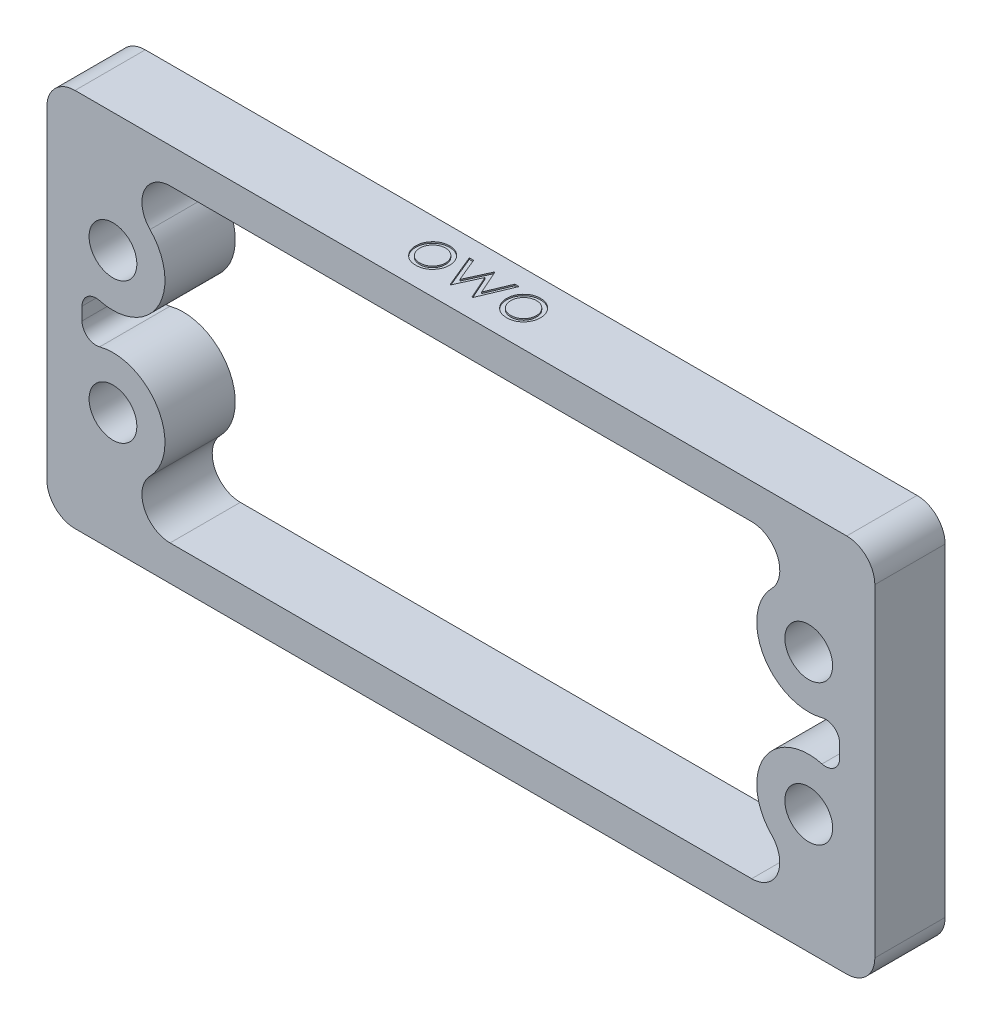
from build123d import *

# Parameters (mm, degrees)
BOSS_EXTRUDE1_OUTLINE_R   = 1.7
BOSS_EXTRUDE1_OUTLINE_R_2 = 1.699388982
BOSS_EXTRUDE1_DEPTH       = 5
FILLET1_R                 = 2
FILLET2_R                 = 1
CUT_EXTRUDE2_DEPTH        = 0.1


# Read off the part's stored shape, not the designer's step: Boss-Extrude1
with BuildPart() as part:
    # Boss-Extrude1 outline → Boss-Extrude1 (new body)
    with BuildSketch(Plane.XY):
        Polygon((29.451299039, 17), (-29.45000185, 17), (-29.45000185, -9.999066432), (29.451299039, -9.998874323), align=None)
        with Locations((-24.75, -1.5)):
            Circle(BOSS_EXTRUDE1_OUTLINE_R, mode=Mode.SUBTRACT)
        with Locations((24.75, -1.5)):
            Circle(BOSS_EXTRUDE1_OUTLINE_R, mode=Mode.SUBTRACT)
        with Locations((-24.75, 8.5)):
            Circle(BOSS_EXTRUDE1_OUTLINE_R, mode=Mode.SUBTRACT)
        with BuildLine():
            Line((26.951299039, 14.5), (22.6554979, 11.549350717))
            ThreePointArc((22.6554979, 11.549350717), (21.738264413, 6.351761747), (26.951299039, 5.526826378))
            Line((26.951299039, 5.526826378), (26.951299039, 1.47393385))
            ThreePointArc((26.951299039, 1.47393385), (21.737319782, 0.647965992), (22.656048895, -4.550470254))
            Line((22.656048895, -4.550470254), (26.951299039, -7.498882477))
            Line((26.951299039, -7.498882477), (-26.95000185, -7.499058278))
            Line((-26.95000185, -7.499058278), (-22.65553415, -4.550116851))
            ThreePointArc((-22.65553415, -4.550116851), (-21.737032665, 0.647563233), (-26.95000185, 1.474893588))
            Line((-26.95000185, 1.474893588), (-26.95000185, 5.525106412))
            ThreePointArc((-26.95000185, 5.525106412), (-21.737192663, 6.352212312), (-22.655079717, 11.549804749))
            Line((-22.655079717, 11.549804749), (-26.95000185, 14.5))
            Line((-26.95000185, 14.5), (26.951299039, 14.5))
        make_face(mode=Mode.SUBTRACT)
        with Locations((24.75, 8.5)):
            Circle(BOSS_EXTRUDE1_OUTLINE_R_2, mode=Mode.SUBTRACT)
    extrude(amount=BOSS_EXTRUDE1_DEPTH)

    # Fillet1
    fillet1_edges = [part.edges().sort_by_distance(p)[0] for p in [
        (26.951299039, -7.498882477, 2.5),
        (-26.95000185, -7.499058278, 2.5),
        (26.951299039, 14.5, 2.5),
        (-26.95000185, 14.5, 2.5),
        (29.451299039, 17, 2.5),
        (-29.45000185, 17, 2.5),
        (-29.45000185, -9.999066432, 2.5),
        (29.451299039, -9.998874323, 2.5),
    ]]
    fillet(fillet1_edges, radius=FILLET1_R)

    # Fillet2
    fillet2_edges = [part.edges().sort_by_distance(p)[0] for p in [
        (-26.95000185, 5.525106412, 2.5),
        (-26.95000185, 1.474893588, 2.5),
        (26.951299039, 1.47393385, 2.5),
        (26.951299039, 5.526826378, 2.5),
    ]]
    fillet(fillet2_edges, radius=FILLET2_R)

    # Sketch4 → Cut-Extrude2 (cut)
    # profile 1 of 3: a face of its own
    with BuildSketch(Plane(origin=(0, 17, 0), x_dir=(1, 0, 0), z_dir=(0, 1, 0))):
        with BuildLine():
            add(Edge.make_bspline(
                [(-4.553692525, -1.249305998), (-4.510157585, -1.250232999), (-4.424796206, -1.252050622), (-4.299784767, -1.271477055), (-4.180454536, -1.301183593), (-4.066348491, -1.342251367), (-3.958927994, -1.397298565), (-3.856628366, -1.462984136), (-3.759730079, -1.540801203), (-3.701652045, -1.600997451), (-3.672172093, -1.631552593)],
                knots=[0, 0, 0, 0, 1.054011418, 2.066658804, 3.057071809, 4.030435133, 4.997543892, 5.974964718, 6.972108034, 8, 8, 8, 8], degree=3))
            add(Edge.make_bspline(
                [(-3.672172093, -1.631552593), (-3.646788463, -1.66077528), (-3.596512446, -1.718655114), (-3.532045687, -1.812504135), (-3.476508986, -1.909695512), (-3.432001872, -2.011519872), (-3.396909029, -2.117088324), (-3.371993719, -2.22676372), (-3.357173785, -2.340303849), (-3.355175379, -2.417414474), (-3.354163278, -2.456467456)],
                knots=[0, 0, 0, 0, 1.025258237, 2.030674902, 3.01204498, 3.988269485, 4.97094183, 5.956517959, 6.965070386, 8, 8, 8, 8], degree=3))
            add(Edge.make_bspline(
                [(-3.354163278, -2.456467456), (-3.355053492, -2.495746794), (-3.356812594, -2.573364598), (-3.373452875, -2.687682166), (-3.399334646, -2.798530326), (-3.436374956, -2.905444998), (-3.483871241, -3.008752992), (-3.541829222, -3.108003083), (-3.610655617, -3.20339109), (-3.688673529, -3.294107043), (-3.774899159, -3.377714966), (-3.868440236, -3.450584182), (-3.967458539, -3.513015137), (-4.073270723, -3.563303885), (-4.184910515, -3.602954827), (-4.302618712, -3.630804128), (-4.426212455, -3.647642227), (-4.510601434, -3.649804468), (-4.553692525, -3.650908562)],
                knots=[0, 0, 0, 0, 0.998656419, 1.973391657, 2.932242238, 3.890759089, 4.846373663, 5.82037756, 6.809684879, 7.83454468, 8.860553229, 9.859544525, 10.845671541, 11.83227036, 12.833544569, 13.85385346, 14.904124723, 16, 16, 16, 16], degree=3))
            add(Edge.make_bspline(
                [(-4.553692525, -3.650908562), (-4.596994735, -3.649800763), (-4.681804301, -3.647631081), (-4.805834299, -3.630869546), (-4.923753453, -3.602967662), (-5.035539396, -3.56317358), (-5.141806507, -3.513013529), (-5.241398544, -3.450772925), (-5.33501561, -3.377693356), (-5.421259481, -3.294112898), (-5.499272502, -3.203389581), (-5.568100159, -3.108003475), (-5.626057812, -3.00875289), (-5.673554183, -2.905445026), (-5.710594471, -2.798530319), (-5.736476247, -2.687682168), (-5.753116526, -2.573364598), (-5.754875629, -2.495746794), (-5.755765843, -2.456467456)],
                knots=[0, 0, 0, 0, 1.099876186, 2.154163076, 3.173186993, 4.173200201, 5.163417411, 6.152872554, 7.150605724, 8.17532212, 9.198891216, 10.186952605, 11.159729845, 12.11414092, 13.071450619, 14.029093627, 15.002601286, 16, 16, 16, 16], degree=3))
            add(Edge.make_bspline(
                [(-5.755765843, -2.456467456), (-5.75474684, -2.417626733), (-5.752729389, -2.340728775), (-5.737924356, -2.227402084), (-5.713106237, -2.11791231), (-5.677971327, -2.012751342), (-5.633053975, -1.911373196), (-5.578297664, -1.813941671), (-5.513173304, -1.720517024), (-5.463097248, -1.662711994), (-5.437757028, -1.633460645)],
                knots=[0, 0, 0, 0, 1.031353054, 2.041901799, 3.029428768, 4.008703097, 4.981709435, 5.96992636, 6.972712378, 8, 8, 8, 8], degree=3))
            add(Edge.make_bspline(
                [(-5.437757028, -1.633460645), (-5.408321521, -1.602640522), (-5.350431416, -1.542027326), (-5.253050784, -1.464437108), (-5.151002818, -1.397384669), (-5.042395206, -1.343431245), (-4.9283829, -1.300942019), (-4.808441158, -1.271400444), (-4.683005512, -1.252120615), (-4.597226427, -1.250253554), (-4.553692525, -1.249305998)],
                knots=[0, 0, 0, 0, 1.027980169, 2.021703884, 2.998553061, 3.971491411, 4.943284454, 5.930300938, 6.949603206, 8, 8, 8, 8], degree=3))
        make_face()
        with BuildLine():
            add(Edge.make_bspline(
                [(-4.554964561, -1.534241895), (-4.585750822, -1.535116918), (-4.646528603, -1.536844374), (-4.735990655, -1.549983345), (-4.822114938, -1.570800009), (-4.905064846, -1.600376546), (-4.984560653, -1.638566261), (-5.060678468, -1.685473131), (-5.133642181, -1.740475884), (-5.202024481, -1.803488451), (-5.264782722, -1.872321539), (-5.319644886, -1.94566255), (-5.366294804, -2.022321878), (-5.405156948, -2.102379241), (-5.434101326, -2.186645931), (-5.455122568, -2.274167647), (-5.468249143, -2.365122703), (-5.469960358, -2.426954484), (-5.470829945, -2.458375509)],
                knots=[0, 0, 0, 0, 1.021534396, 2.016698045, 2.994645724, 3.958388632, 4.93408049, 5.916473867, 6.921342795, 7.962252576, 8.998418191, 10.008913653, 10.997312074, 11.973003931, 12.956656626, 13.948281152, 14.957379055, 16, 16, 16, 16], degree=3))
            add(Edge.make_bspline(
                [(-5.470829945, -2.458375509), (-5.469372327, -2.498971991), (-5.466479226, -2.579548416), (-5.442952262, -2.698212791), (-5.403594708, -2.812133472), (-5.350447676, -2.920642622), (-5.283857749, -3.021038188), (-5.205401624, -3.110547321), (-5.115921324, -3.187823021), (-5.016483499, -3.251940645), (-4.909119225, -3.302885566), (-4.795493848, -3.338988923), (-4.676984075, -3.362458244), (-4.595993698, -3.364790938), (-4.554964561, -3.365972665)],
                knots=[0, 0, 0, 0, 1.016792936, 2.018143844, 3.017858371, 4.030088057, 5.03801393, 6.028138512, 7.003788237, 7.991172063, 8.984598303, 9.972568034, 10.972917682, 12, 12, 12, 12], degree=3))
            add(Edge.make_bspline(
                [(-4.554964561, -3.365972665), (-4.513937783, -3.364784053), (-4.432952064, -3.362437767), (-4.314606953, -3.339107124), (-4.201292136, -3.302727374), (-4.094039377, -3.251997941), (-3.994646816, -3.187579536), (-3.90452297, -3.11098368), (-3.82673673, -3.020801115), (-3.760212674, -2.920509642), (-3.706195272, -2.812301694), (-3.667021939, -2.698191766), (-3.643438414, -2.579553771), (-3.640552948, -2.498973785), (-3.639099176, -2.458375509)],
                knots=[0, 0, 0, 0, 1.02726834, 2.027799167, 3.010890988, 4.004497153, 4.992059811, 5.971914811, 6.958719428, 7.966827853, 8.981595046, 9.981490638, 10.983022906, 12, 12, 12, 12], degree=3))
            add(Edge.make_bspline(
                [(-3.639099176, -2.458375509), (-3.639968464, -2.426954296), (-3.641679089, -2.365122146), (-3.65480995, -2.274169777), (-3.675815332, -2.186638114), (-3.704818157, -2.102408083), (-3.743511441, -2.022114597), (-3.79106096, -1.94588763), (-3.845699104, -1.872067478), (-3.909214636, -1.803710961), (-3.977525557, -1.74045132), (-4.050518842, -1.685451803), (-4.126523786, -1.638772413), (-4.205788644, -1.600049894), (-4.288749187, -1.571069093), (-4.374752797, -1.549863148), (-4.463833146, -1.536899899), (-4.524393135, -1.535133563), (-4.554964561, -1.534241895)],
                knots=[0, 0, 0, 0, 1.042956736, 2.052379634, 3.044323526, 4.02829302, 5.004299113, 5.996692471, 7.007513377, 8.048758398, 9.090003419, 10.095195979, 11.07790575, 12.047570684, 13.018257071, 13.989683339, 14.985167495, 16, 16, 16, 16], degree=3))
        make_face(mode=Mode.SUBTRACT)
    # profile 2 of 3: a face of its own
    with BuildSketch(Plane(origin=(0, 17, 0), x_dir=(1, 0, 0), z_dir=(0, 1, 0))):
        Polygon((-3.109932509, -1.290011126), (-2.80400803, -1.290011126), (-2.112656868, -2.958921383), (-1.355159873, -1.290011126), (-1.306822533, -1.290011126), (-0.565861996, -2.958921383), (0.131849342, -1.290011126), (0.431413645, -1.290011126), (-0.538513238, -3.610203434), (-0.597662878, -3.610203434), (-1.339259432, -1.941293177), (-2.09612041, -3.610203434), (-2.148909873, -3.610203434), align=None)
    # profile 3 of 3: a face of its own
    with BuildSketch(Plane(origin=(0, 17, 0), x_dir=(1, 0, 0), z_dir=(0, 1, 0))):
        with BuildLine():
            add(Edge.make_bspline(
                [(1.918422859, -1.249305998), (1.9619578, -1.250232999), (2.047319178, -1.252050622), (2.172330618, -1.271477055), (2.291660848, -1.301183593), (2.405766894, -1.342251367), (2.51318739, -1.397298565), (2.615487019, -1.462984136), (2.712385306, -1.540801203), (2.770463339, -1.600997451), (2.799943292, -1.631552593)],
                knots=[0, 0, 0, 0, 1.054011418, 2.066658804, 3.057071809, 4.030435133, 4.997543892, 5.974964718, 6.972108034, 8, 8, 8, 8], degree=3))
            add(Edge.make_bspline(
                [(2.799943292, -1.631552593), (2.825326922, -1.66077528), (2.875602938, -1.718655114), (2.940069697, -1.812504135), (2.995606398, -1.909695512), (3.040113513, -2.011519872), (3.075206356, -2.117088324), (3.100121666, -2.22676372), (3.1149416, -2.340303849), (3.116940006, -2.417414474), (3.117952106, -2.456467456)],
                knots=[0, 0, 0, 0, 1.025258237, 2.030674902, 3.01204498, 3.988269485, 4.97094183, 5.956517959, 6.965070386, 8, 8, 8, 8], degree=3))
            add(Edge.make_bspline(
                [(3.117952106, -2.456467456), (3.117061893, -2.495746794), (3.11530279, -2.573364598), (3.09866251, -2.687682166), (3.072780739, -2.798530326), (3.035740429, -2.905444998), (2.988244144, -3.008752992), (2.930286163, -3.108003083), (2.861459767, -3.20339109), (2.783441856, -3.294107043), (2.697216226, -3.377714966), (2.603675148, -3.450584182), (2.504656846, -3.513015137), (2.398844661, -3.563303885), (2.28720487, -3.602954827), (2.169496672, -3.630804128), (2.04590293, -3.647642227), (1.96151395, -3.649804468), (1.918422859, -3.650908562)],
                knots=[0, 0, 0, 0, 0.998656419, 1.973391657, 2.932242238, 3.890759089, 4.846373663, 5.82037756, 6.809684879, 7.83454468, 8.860553229, 9.859544525, 10.845671541, 11.83227036, 12.833544569, 13.85385346, 14.904124723, 16, 16, 16, 16], degree=3))
            add(Edge.make_bspline(
                [(1.918422859, -3.650908562), (1.87512065, -3.649800763), (1.790311084, -3.647631081), (1.666281086, -3.630869546), (1.548361932, -3.602967662), (1.436575989, -3.56317358), (1.330308878, -3.513013529), (1.230716841, -3.450772925), (1.137099775, -3.377693356), (1.050855903, -3.294112898), (0.972842883, -3.203389581), (0.904015225, -3.108003475), (0.846057572, -3.00875289), (0.798561201, -2.905445026), (0.761520914, -2.798530319), (0.735639137, -2.687682168), (0.718998858, -2.573364598), (0.717239755, -2.495746794), (0.716349542, -2.456467456)],
                knots=[0, 0, 0, 0, 1.099876186, 2.154163076, 3.173186993, 4.173200201, 5.163417411, 6.152872554, 7.150605724, 8.17532212, 9.198891216, 10.186952605, 11.159729845, 12.11414092, 13.071450619, 14.029093627, 15.002601286, 16, 16, 16, 16], degree=3))
            add(Edge.make_bspline(
                [(0.716349542, -2.456467456), (0.717368545, -2.417626733), (0.719385996, -2.340728775), (0.734191029, -2.227402084), (0.759009148, -2.11791231), (0.794144058, -2.012751342), (0.839061409, -1.911373196), (0.893817721, -1.813941671), (0.95894208, -1.720517024), (1.009018136, -1.662711994), (1.034358356, -1.633460645)],
                knots=[0, 0, 0, 0, 1.031353054, 2.041901799, 3.029428768, 4.008703097, 4.981709435, 5.96992636, 6.972712378, 8, 8, 8, 8], degree=3))
            add(Edge.make_bspline(
                [(1.034358356, -1.633460645), (1.063793864, -1.602640522), (1.121683969, -1.542027326), (1.2190646, -1.464437108), (1.321112567, -1.397384669), (1.429720178, -1.343431245), (1.543732485, -1.300942019), (1.663674227, -1.271400444), (1.789109873, -1.252120615), (1.874888958, -1.250253554), (1.918422859, -1.249305998)],
                knots=[0, 0, 0, 0, 1.027980169, 2.021703884, 2.998553061, 3.971491411, 4.943284454, 5.930300938, 6.949603206, 8, 8, 8, 8], degree=3))
        make_face()
        with BuildLine():
            add(Edge.make_bspline(
                [(1.917150824, -1.534241895), (1.886364562, -1.535116918), (1.825586781, -1.536844374), (1.73612473, -1.549983345), (1.650000447, -1.570800009), (1.567050538, -1.600376546), (1.487554732, -1.638566261), (1.411436917, -1.685473131), (1.338473204, -1.740475884), (1.270090903, -1.803488451), (1.207332663, -1.872321539), (1.152470499, -1.94566255), (1.105820581, -2.022321878), (1.066958436, -2.102379241), (1.038014059, -2.186645931), (1.016992817, -2.274167647), (1.003866242, -2.365122703), (1.002155027, -2.426954484), (1.001285439, -2.458375509)],
                knots=[0, 0, 0, 0, 1.021534396, 2.016698045, 2.994645724, 3.958388632, 4.93408049, 5.916473867, 6.921342795, 7.962252576, 8.998418191, 10.008913653, 10.997312074, 11.973003931, 12.956656626, 13.948281152, 14.957379055, 16, 16, 16, 16], degree=3))
            add(Edge.make_bspline(
                [(1.001285439, -2.458375509), (1.002743058, -2.498971991), (1.005636158, -2.579548416), (1.029163123, -2.698212791), (1.068520677, -2.812133472), (1.121667709, -2.920642622), (1.188257636, -3.021038188), (1.266713761, -3.110547321), (1.35619406, -3.187823021), (1.455631886, -3.251940645), (1.56299616, -3.302885566), (1.676621537, -3.338988923), (1.795131309, -3.362458244), (1.876121687, -3.364790938), (1.917150824, -3.365972665)],
                knots=[0, 0, 0, 0, 1.016792936, 2.018143844, 3.017858371, 4.030088057, 5.03801393, 6.028138512, 7.003788237, 7.991172063, 8.984598303, 9.972568034, 10.972917682, 12, 12, 12, 12], degree=3))
            add(Edge.make_bspline(
                [(1.917150824, -3.365972665), (1.958177602, -3.364784053), (2.039163321, -3.362437767), (2.157508431, -3.339107124), (2.270823249, -3.302727374), (2.378076007, -3.251997941), (2.477468569, -3.187579536), (2.567592415, -3.11098368), (2.645378655, -3.020801115), (2.711902711, -2.920509642), (2.765920113, -2.812301694), (2.805093446, -2.698191766), (2.82867697, -2.579553771), (2.831562436, -2.498973785), (2.833016209, -2.458375509)],
                knots=[0, 0, 0, 0, 1.02726834, 2.027799167, 3.010890988, 4.004497153, 4.992059811, 5.971914811, 6.958719428, 7.966827853, 8.981595046, 9.981490638, 10.983022906, 12, 12, 12, 12], degree=3))
            add(Edge.make_bspline(
                [(2.833016209, -2.458375509), (2.832146921, -2.426954296), (2.830436295, -2.365122146), (2.817305435, -2.274169777), (2.796300052, -2.186638114), (2.767297228, -2.102408083), (2.728603944, -2.022114597), (2.681054425, -1.94588763), (2.62641628, -1.872067478), (2.562900749, -1.803710961), (2.494589828, -1.74045132), (2.421596543, -1.685451803), (2.345591598, -1.638772413), (2.266326741, -1.600049894), (2.183366198, -1.571069093), (2.097362587, -1.549863148), (2.008282238, -1.536899899), (1.947722249, -1.535133563), (1.917150824, -1.534241895)],
                knots=[0, 0, 0, 0, 1.042956736, 2.052379634, 3.044323526, 4.02829302, 5.004299113, 5.996692471, 7.007513377, 8.048758398, 9.090003419, 10.095195979, 11.07790575, 12.047570684, 13.018257071, 13.989683339, 14.985167495, 16, 16, 16, 16], degree=3))
        make_face(mode=Mode.SUBTRACT)
    extrude(amount=-CUT_EXTRUDE2_DEPTH, mode=Mode.SUBTRACT)


solid = part.part
